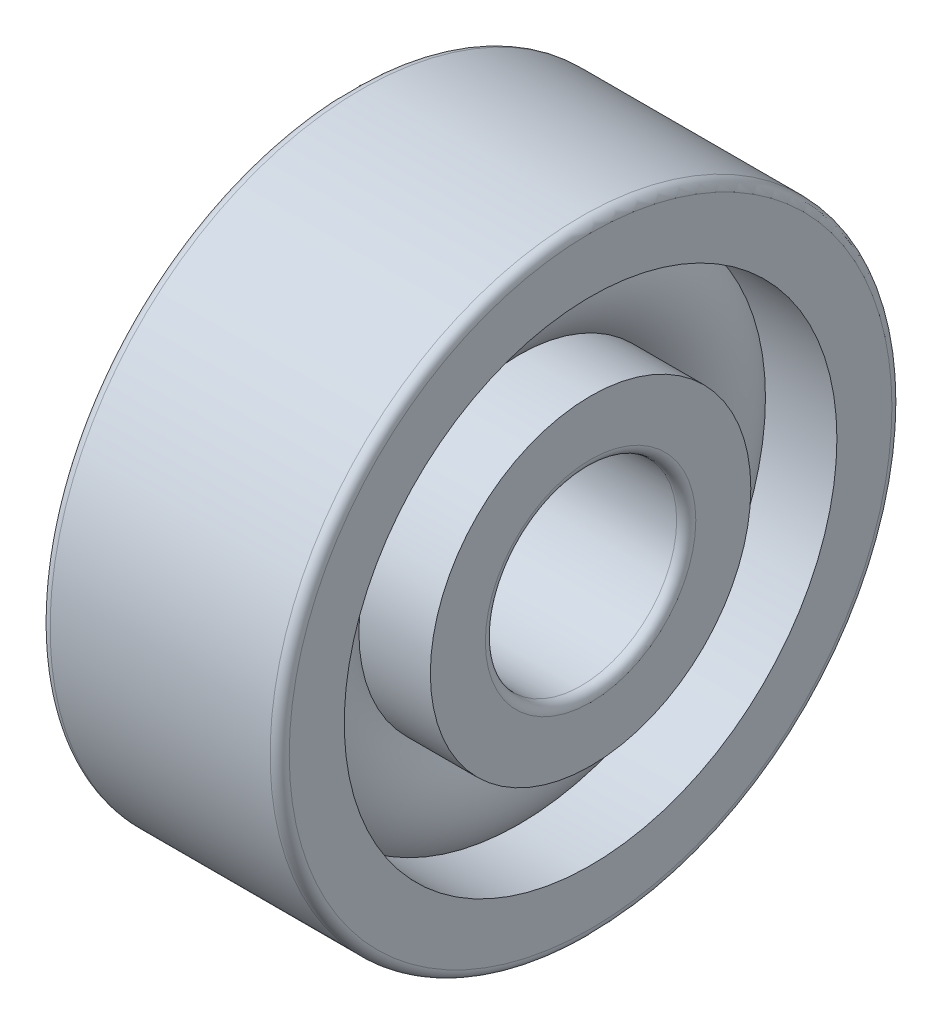
from build123d import *

# Parameters (mm, degrees)
CAGSPISKE_W     = 0.27
CAGSPISKE_H     = 0.45
CAGESPINE_ANGLE = 0.001
BALSIMSKE_R     = 1.35


with BuildPart() as part:
    # CagSpiSke → CageSpine (revolve)
    with BuildSketch(Plane.XY):
        with Locations((0, 4.25)):
            Rectangle(CAGSPISKE_W, CAGSPISKE_H)
    revolve(axis=Axis((-20.6375, 0, 0), (1, 0, 0)), revolution_arc=CAGESPINE_ANGLE)

    # BalSimSke → BallsSimplified (revolve)
    with BuildSketch(Plane.XY):
        with Locations((0, 4.25)):
            Circle(BALSIMSKE_R)
    revolve(axis=Axis((-10, 0, 0), (1, 0, 0)))

    # InnRacSke → InnerRace (revolve)
    with BuildSketch(Plane.XY):
        with BuildLine():
            Line((-0.972432517, 3.35), (-2.5, 3.35))
            Line((-2.5, 3.35), (-2.5, 2.2))
            ThreePointArc((-2.5, 2.2), (-2.441421356, 2.058578644), (-2.3, 2))
            Line((-2.3, 2), (2.3, 2))
            ThreePointArc((2.3, 2), (2.441421356, 2.058578644), (2.5, 2.2))
            Line((2.5, 2.2), (2.5, 3.35))
            Line((2.5, 3.35), (0.972432517, 3.35))
            ThreePointArc((0.972432517, 3.35), (0, 2.925), (-0.972432517, 3.35))
        make_face()
    revolve(axis=Axis((-20.6375, 0, 0), (1, 0, 0)))

    # OutRacSke → OuterRace (revolve)
    with BuildSketch(Plane.XY):
        with BuildLine():
            Line((-0.972432517, 5.15), (-2.5, 5.15))
            Line((-2.5, 5.15), (-2.5, 6.3))
            ThreePointArc((-2.5, 6.3), (-2.441421356, 6.441421356), (-2.3, 6.5))
            Line((-2.3, 6.5), (2.3, 6.5))
            ThreePointArc((2.3, 6.5), (2.441421356, 6.441421356), (2.5, 6.3))
            Line((2.5, 6.3), (2.5, 5.15))
            Line((2.5, 5.15), (0.972432517, 5.15))
            ThreePointArc((0.972432517, 5.15), (0, 5.575), (-0.972432517, 5.15))
        make_face()
    revolve(axis=Axis((-20.6375, 0, 0), (1, 0, 0)))


solid = part.part
